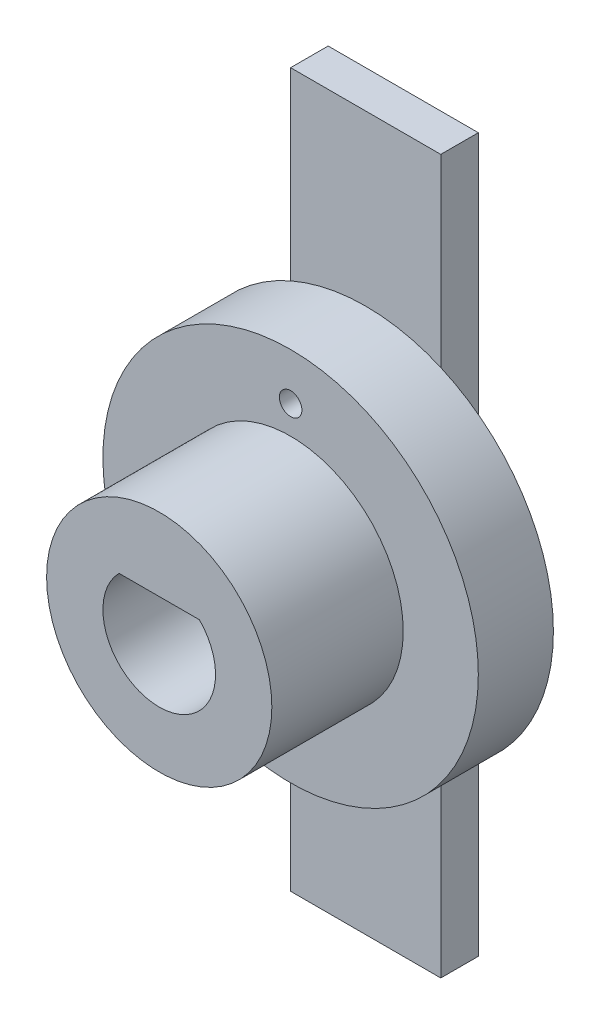
from build123d import *

# Parameters (mm, degrees)
ESQUISSE1_R        = 10
ESQUISSE1_R_2      = 0.6
BOSS_EXTRU_1_DEPTH = 4
ESQUISSE3_R        = 6
BOSS_EXTRU_2_DEPTH = 7
ESQUISSE4_W        = 8
ESQUISSE4_H        = 38
BOSS_EXTRU_3_DEPTH = 2


with BuildPart() as part:
    # Esquisse1 → Boss.-Extru.1 (new body)
    with BuildSketch(Plane.XY):
        Circle(ESQUISSE1_R)
        with Locations((0, -7.5)):
            Circle(ESQUISSE1_R_2, mode=Mode.SUBTRACT)
        with Locations((0, 7.5)):
            Circle(ESQUISSE1_R_2, mode=Mode.SUBTRACT)
    extrude(amount=BOSS_EXTRU_1_DEPTH)

    # Esquisse3 → Boss.-Extru.2 (add)
    with BuildSketch(Plane.XY.offset(4)):
        Circle(ESQUISSE3_R)
        with BuildLine():
            Line((-2.142428529, 2.1), (2.142428529, 2.1))
            ThreePointArc((2.142428529, 2.1), (0, -3), (-2.142428529, 2.1))
        make_face(mode=Mode.SUBTRACT)
    extrude(amount=BOSS_EXTRU_2_DEPTH)

    # Esquisse4 → Boss.-Extru.3 (add)
    with BuildSketch(Plane(origin=(0, 0, 0), x_dir=(-1, 0, 0), z_dir=(0, 0, -1))):
        Rectangle(ESQUISSE4_W, ESQUISSE4_H)
    extrude(amount=BOSS_EXTRU_3_DEPTH)


solid = part.part
